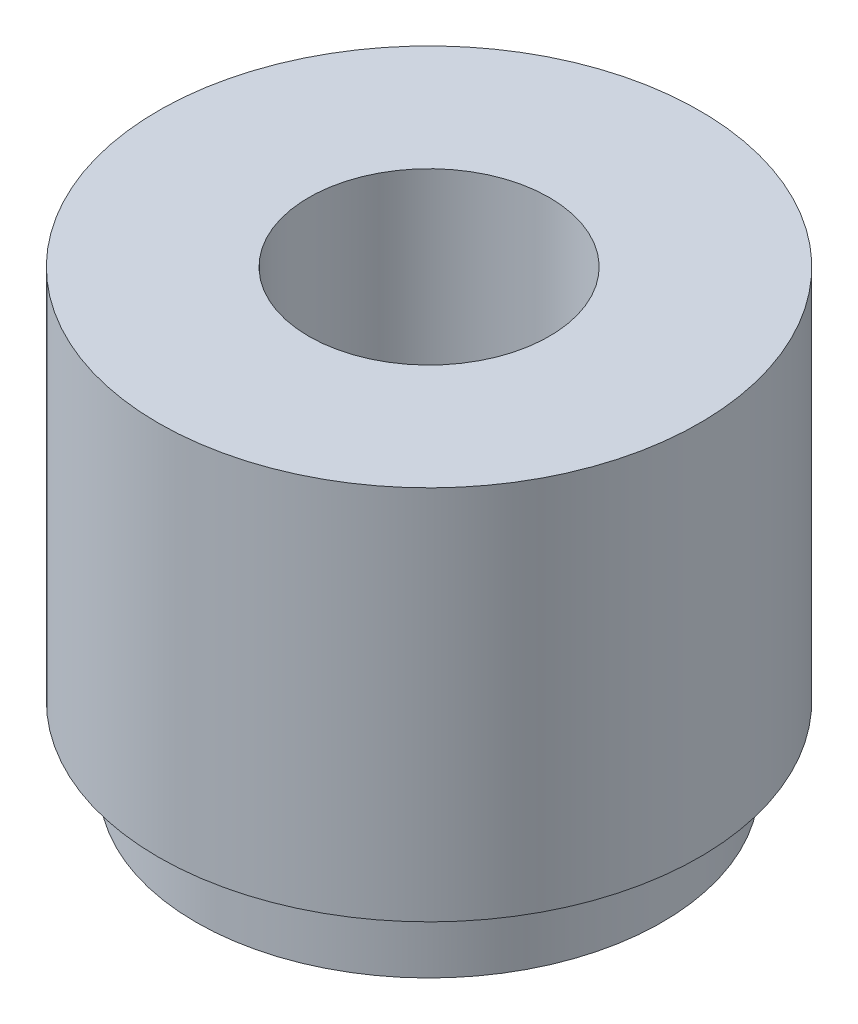
from build123d import *

# Parameters (mm, degrees)
TAP_DRILL_FOR_M2_TAP1_D = 1.6


with BuildPart() as part:
    # Sketch1 → Revolve1 (revolve)
    with BuildSketch(Plane.XY):
        Polygon((0, 0), (1.55, 0), (1.55, 0.5), (1.8, 0.5), (1.8, 3), (0, 3), align=None)
    revolve(axis=Axis((0, 3, 0), (0, -1, 0)))

    # Tap Drill for M2 Tap1 (through all)
    with Locations(Plane(origin=(0, 3, 0), x_dir=(1, 0, 0), z_dir=(0, 1, 0))):
        with Locations((0, 0)):
            Hole(TAP_DRILL_FOR_M2_TAP1_D / 2)


solid = part.part
